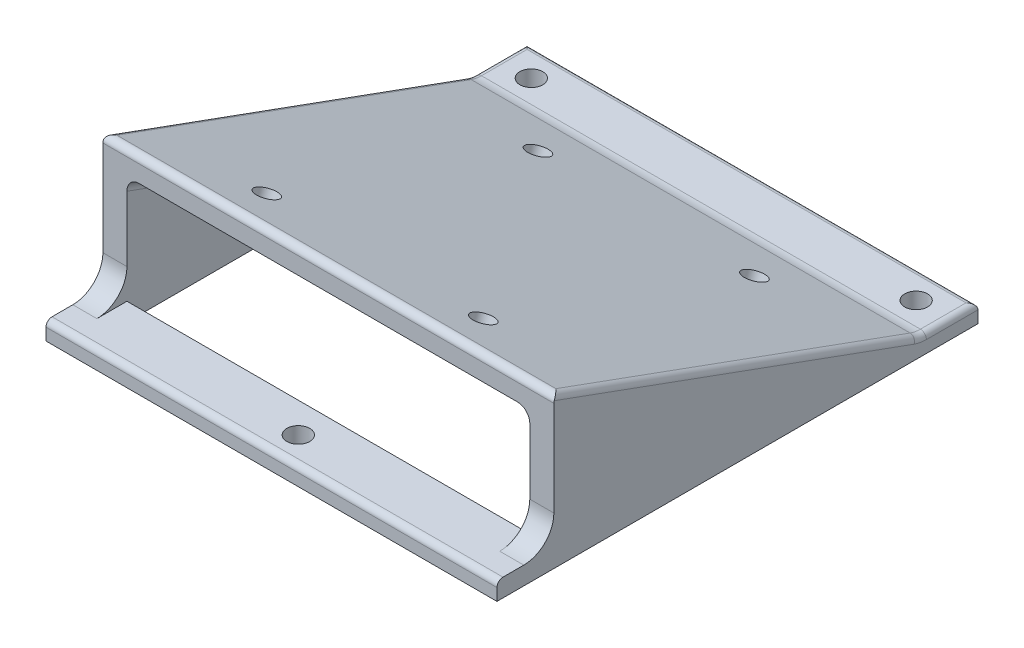
from build123d import *

# Parameters (mm, degrees)
EXTRUDE_1_DEPTH          = 37.5
SHELL_START              = -33.5
SHELL_1_DEPTH            = 67
FILLET_1_R               = 5
FILLET_3_R               = 2
FILLET_4_R               = 1
CUT_EXTRUDE_2_DEPTH      = 94.307288033
CUT_EXTRUDE_2_DEPTH_BACK = 3
SKETCH_3_R               = 1.9
CUT_EXTRUDE_1_DEPTH      = 103.419810201
CUT_EXTRUDE_1_DEPTH_BACK = 103.419810201
SKETCH_2_W               = 80
SKETCH_2_H               = 27
CUT_EXTRUDE_3_REACH      = 102.177
SKETCH_4_R               = 1.8


# Read off the part's stored shape, not the designer's step: 抽壳1
with BuildPart() as part:
    # 草图1 → 凸台-拉伸1 (new, symmetric)
    with BuildSketch(Plane(origin=(0, 0, 0), x_dir=(0, 0, -1), z_dir=(1, 0, 0))):
        Polygon((-70.540010176, 52.231309316), (-70.540010176, 30), (-80, 30), (-80, 0), (0, 0), (0, 30), (-9.459989824, 30), align=None)
    extrude(amount=EXTRUDE_1_DEPTH, both=True)

    # 抽壳1 outline → 抽壳1 (cut)
    with BuildSketch(Plane.YZ.offset(SHELL_START)):
        Polygon((47.974598226, 70.540010176), (22, 70.540010176), (22, 80), (4, 80), (4, 6), (24.483955603, 6), align=None)
    extrude(amount=SHELL_1_DEPTH, mode=Mode.SUBTRACT)

    # 圆角1
    fillet_1_edges = [part.edges().sort_by_distance(p)[0] for p in [
        (0, 30, 9.459989824),
        (35.5, 30, 70.540010176),
        (-35.5, 30, 70.540010176),
    ]]
    fillet(fillet_1_edges, radius=FILLET_1_R)

    # 圆角3
    fillet_3_edges = [part.edges().sort_by_distance(p)[0] for p in [
        (33.5, 4, 43),
        (33.5, 36.229276914, 38.270005088),
        (-33.5, 36.229276914, 38.270005088),
        (-33.5, 4, 43),
    ]]
    fillet(fillet_3_edges, radius=FILLET_3_R)

    # 圆角4
    fillet_4_edges = [part.edges().sort_by_distance(p)[0] for p in [
        (-37.5, 30, 4.28917746),
        (-37.5, 30.075961235, 9.446595809),
        (37.5, 30, 4.28917746),
        (37.5, 30.075961235, 9.446595809),
        (-37.5, 41.266423106, 40.414232907),
        (0, 52.231309316, 70.540010176),
        (37.5, 41.266423106, 40.414232907),
        (37.5, 0, 40),
        (-37.5, 0, 40),
        (0, 0, 80),
        (0, 0, 0),
        (0, 30, 0),
        (0, 30, 80),
    ]]
    fillet(fillet_4_edges, radius=FILLET_4_R)

    # 草图3 → 切除-拉伸2 (cut, two sides: drawn at the far end of the back side and taken through both)
    with BuildSketch(Plane(origin=(0, 30, 0), x_dir=(1, 0, 0), z_dir=(0, 1, 0)).offset(-CUT_EXTRUDE_2_DEPTH_BACK)):
        with Locations(Location((-32, -4.78917746, 0), (0, 0, 90))):
            Circle(SKETCH_3_R)
        with Locations(Location((32, -4.78917746, 0), (0, 0, 90))):
            Circle(SKETCH_3_R)
        with Locations(Location((0, -75.540010176, 0), (0, 0, 90))):
            Circle(SKETCH_3_R)
    extrude(amount=CUT_EXTRUDE_2_DEPTH + CUT_EXTRUDE_2_DEPTH_BACK, mode=Mode.SUBTRACT)

    # 草图2 → 切除-拉伸1 (cut, two sides: drawn at the far end of the back side and taken through both)
    with BuildSketch(Plane(origin=(0, 0, 0), x_dir=(0, 0, -1), z_dir=(1, 0, 0)).offset(-CUT_EXTRUDE_1_DEPTH_BACK)):
        with Locations((-40, 13.5)):
            Rectangle(SKETCH_2_W, SKETCH_2_H)
    extrude(amount=CUT_EXTRUDE_1_DEPTH + CUT_EXTRUDE_1_DEPTH_BACK, mode=Mode.SUBTRACT)

    # 草图4 → 切除-拉伸3 (cut, up to next)
    with BuildSketch(Plane(origin=(0, 19.69151404, -7.167124978), x_dir=(1, 0, 0), z_dir=(0, -0.9396926207859104, 0.34202014332566316)), mode=Mode.PRIVATE) as cut_extrude_3_sk1:
        with Locations(Location((-18, 75.900768948, 0), (0, 0, 270))):
            Circle(SKETCH_4_R)
    cut_extrude_3_tool1 = extrude(cut_extrude_3_sk1.sketch, amount=-CUT_EXTRUDE_3_REACH, mode=Mode.PRIVATE) & part.part
    # 草图4 → 切除-拉伸3 (cut, up to next)
    with BuildSketch(Plane(origin=(0, 19.69151404, -7.167124978), x_dir=(1, 0, 0), z_dir=(0, -0.9396926207859104, 0.34202014332566316)), mode=Mode.PRIVATE) as cut_extrude_3_sk2:
        with Locations(Location((18, 75.900768948, 0), (0, 0, 270))):
            Circle(SKETCH_4_R)
    cut_extrude_3_tool2 = extrude(cut_extrude_3_sk2.sketch, amount=-CUT_EXTRUDE_3_REACH, mode=Mode.PRIVATE) & part.part
    # 草图4 → 切除-拉伸3 (cut, up to next)
    with BuildSketch(Plane(origin=(0, 19.69151404, -7.167124978), x_dir=(1, 0, 0), z_dir=(0, -0.9396926207859104, 0.34202014332566316)), mode=Mode.PRIVATE) as cut_extrude_3_sk3:
        with Locations(Location((-18, 27.900768948, 0), (0, 0, 270))):
            Circle(SKETCH_4_R)
    cut_extrude_3_tool3 = extrude(cut_extrude_3_sk3.sketch, amount=-CUT_EXTRUDE_3_REACH, mode=Mode.PRIVATE) & part.part
    # 草图4 → 切除-拉伸3 (cut, up to next)
    with BuildSketch(Plane(origin=(0, 19.69151404, -7.167124978), x_dir=(1, 0, 0), z_dir=(0, -0.9396926207859104, 0.34202014332566316)), mode=Mode.PRIVATE) as cut_extrude_3_sk4:
        with Locations(Location((18, 27.900768948, 0), (0, 0, 270))):
            Circle(SKETCH_4_R)
    cut_extrude_3_tool4 = extrude(cut_extrude_3_sk4.sketch, amount=-CUT_EXTRUDE_3_REACH, mode=Mode.PRIVATE) & part.part
    add(cut_extrude_3_tool1.solids().sort_by_distance((-18, 45.651106, 64.156268))[0], mode=Mode.SUBTRACT)
    add(cut_extrude_3_tool2.solids().sort_by_distance((18, 45.651106, 64.156268))[0], mode=Mode.SUBTRACT)
    add(cut_extrude_3_tool3.solids().sort_by_distance((-18, 29.234139, 19.051022))[0], mode=Mode.SUBTRACT)
    add(cut_extrude_3_tool4.solids().sort_by_distance((18, 29.234139, 19.051022))[0], mode=Mode.SUBTRACT)


solid = part.part
